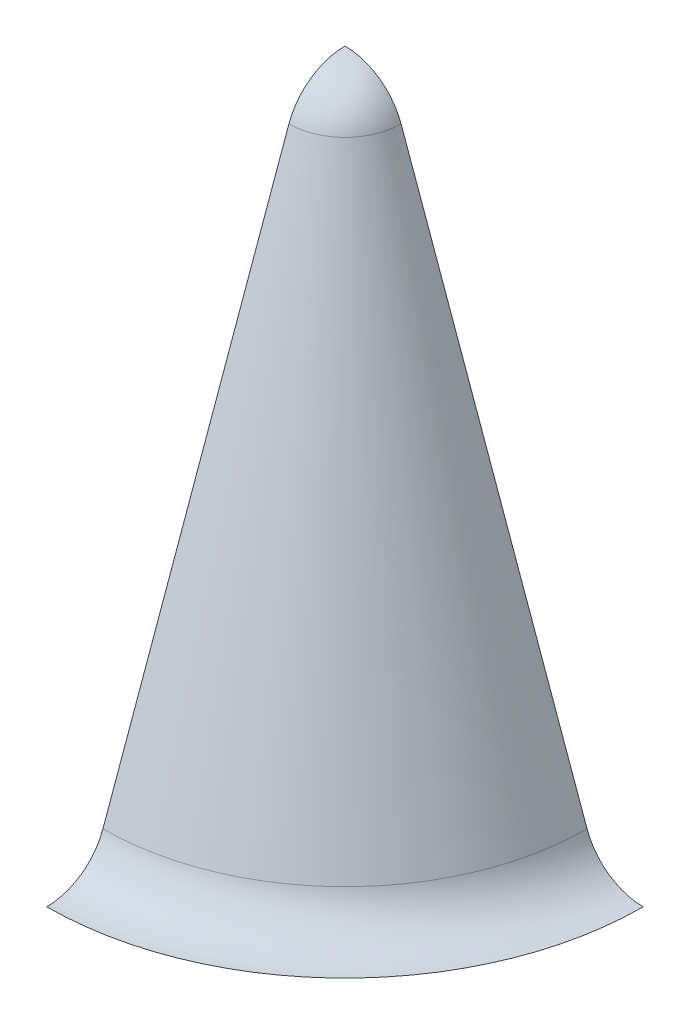
from build123d import *

# Parameters (mm, degrees)
SCHNITT_LINEAR_AUSTRAGEN1_DEPTH = 4000


with BuildPart() as part:
    # Skizze2 → Rotation1 (revolve)
    with BuildSketch(Plane(origin=(0, 0, 0), x_dir=(0, 0, -1), z_dir=(1, 0, 0))):
        with BuildLine():
            Line((0, 0), (1000, 0))
            Line((1000, 0), (1000, 2000))
            ThreePointArc((1000, 2000), (884.950154707, 1963.595638995), (811.783470431, 1867.635330981))
            Line((811.783470431, 1867.635330981), (188.216529569, 132.364669019))
            ThreePointArc((188.216529569, 132.364669019), (115.049845293, 36.404361005), (0, 0))
        make_face()
    revolve(axis=Axis((0, 0, -1000), (0, 1, 0)))

    # Skizze3 → Schnitt-Linear austragen1 (cut)
    with BuildSketch(Plane(origin=(0, 0, 0), x_dir=(1, 0, 0), z_dir=(0, 1, 0))):
        with BuildLine():
            Line((0, 0), (0, 1000))
            Line((0, 1000), (1000, 1000))
            ThreePointArc((1000, 1000), (-707.106781187, 1707.106781187), (0, 0))
        make_face()
    extrude(amount=SCHNITT_LINEAR_AUSTRAGEN1_DEPTH, mode=Mode.SUBTRACT)


solid = part.part
